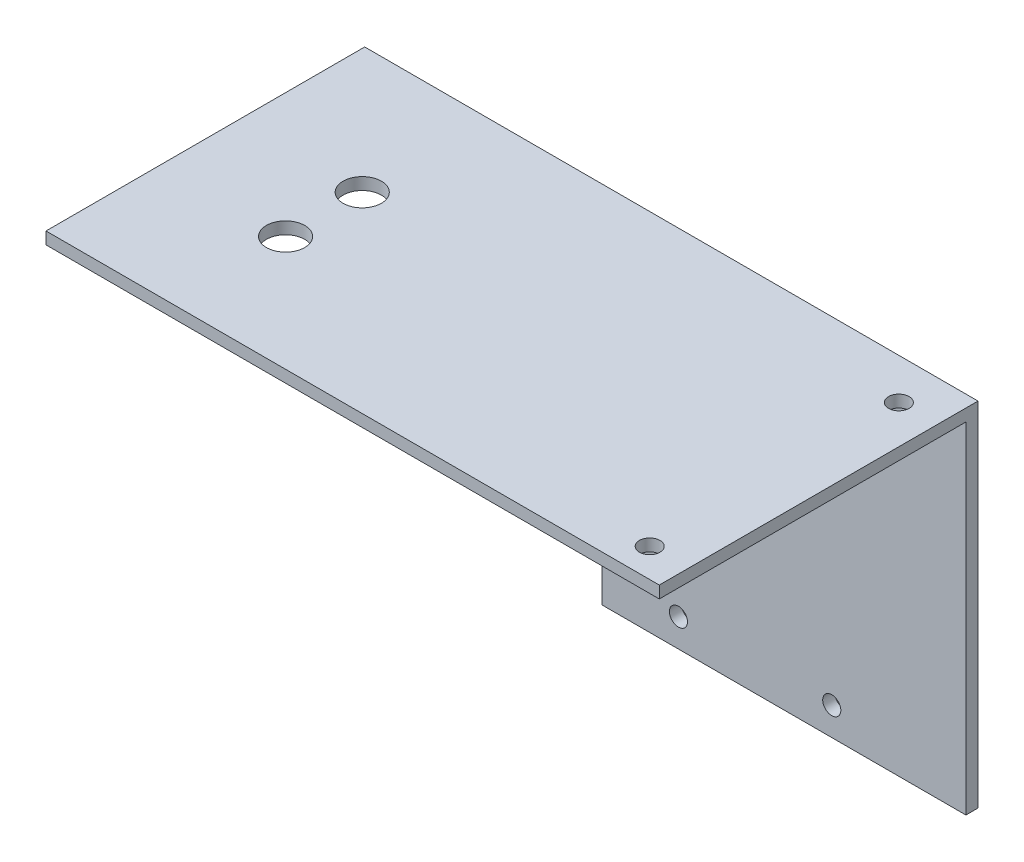
from build123d import *

# Parameters (mm, degrees)
SKETCH1_W           = 60.325
SKETCH1_H           = 58.4
SKETCH1_R           = 1.5
BOSS_EXTRUDE1_DEPTH = 2
BOSS_EXTRUDE2_DEPTH = 52.8
SKETCH3_R           = 1.7
SKETCH3_R_2         = 3.175
CUT_EXTRUDE1_DEPTH  = 99.134120595


with BuildPart() as part:
    # Sketch1 → Boss-Extrude1 (new body)
    with BuildSketch(Plane.XY):
        with Locations((30.1625, 29.2)):
            Rectangle(SKETCH1_W, SKETCH1_H)
        with Locations((12.7, 51.75)):
            Circle(SKETCH1_R, mode=Mode.SUBTRACT)
        with Locations((38.1, 51.75)):
            Circle(SKETCH1_R, mode=Mode.SUBTRACT)
        with Locations((12.7, 4.65)):
            Circle(SKETCH1_R, mode=Mode.SUBTRACT)
        with Locations((38.1, 4.65)):
            Circle(SKETCH1_R, mode=Mode.SUBTRACT)
    extrude(amount=-BOSS_EXTRUDE1_DEPTH)

    # Sketch2 → Boss-Extrude2 (add)
    with BuildSketch(Plane(origin=(0, 0, -2), x_dir=(-1, 0, 0), z_dir=(0, 0, -1))):
        Polygon((0, 56.4), (41.275, 56.4), (41.275, 58.4), (0, 58.4), (-60.325, 58.4), (-60.325, 56.4), align=None)
    extrude(amount=-BOSS_EXTRUDE2_DEPTH)

    # Sketch3 → Cut-Extrude1 (cut, through all)
    with BuildSketch(Plane(origin=(0, 58.4, 0), x_dir=(1, 0, 0), z_dir=(0, 1, 0))):
        with Locations((53.975, -4.7625)):
            Circle(SKETCH3_R)
        with Locations((53.975, -46.0375)):
            Circle(SKETCH3_R)
        with Locations((-20.6375, -31.75)):
            Circle(SKETCH3_R_2)
        with Locations((-20.6375, -19.05)):
            Circle(SKETCH3_R_2)
    extrude(amount=-CUT_EXTRUDE1_DEPTH, mode=Mode.SUBTRACT)


solid = part.part
